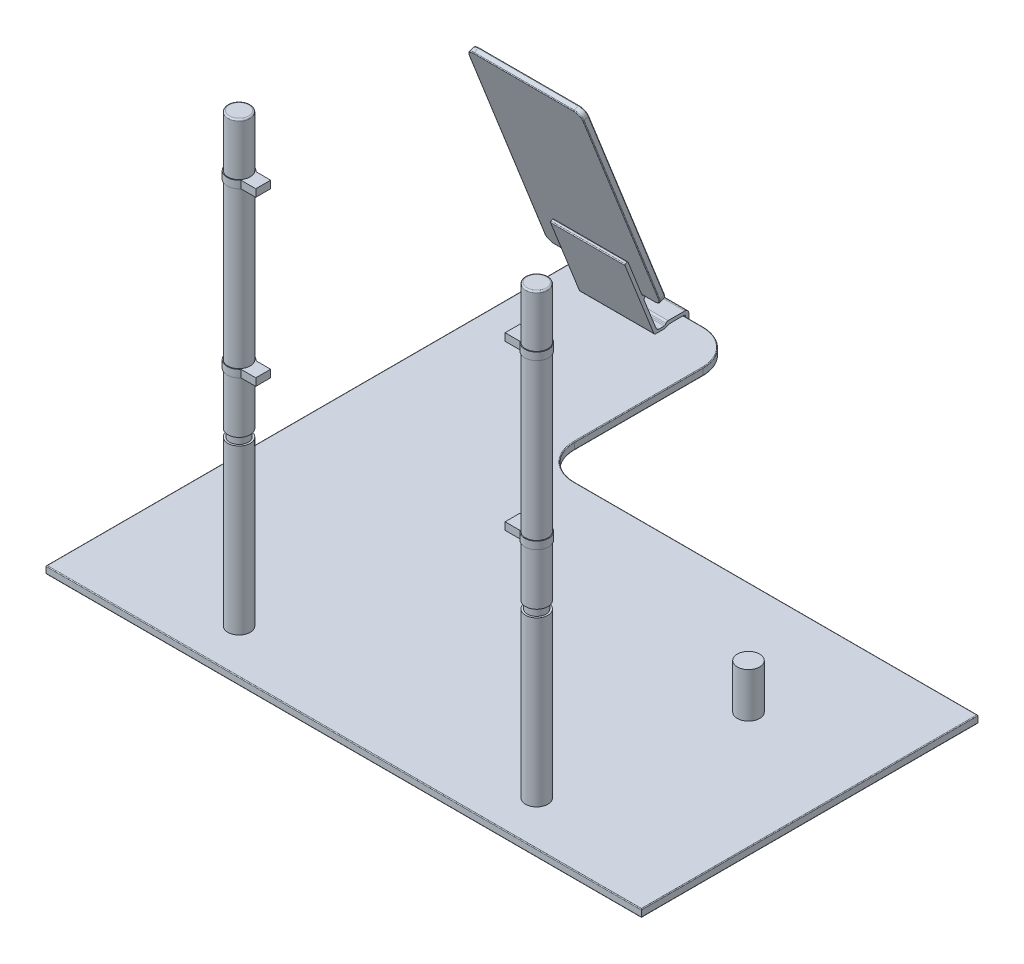
from build123d import *

# Parameters (mm, degrees)
BOSS_EXTRUDE1_DEPTH  = 5
SKETCH3_R            = 7.500000000000014
BOSS_EXTRUDE2_DEPTH  = 300
CUT_EXTRUDE1_START   = -40
SKETCH4_R            = 7.500000000000014
SKETCH4_R_2          = 6.250000000000003
CUT_EXTRUDE1_DEPTH   = 5
CUT_EXTRUDE2_START   = -190
SKETCH4_2_R          = 7.500000000000014
SKETCH4_2_R_2        = 6.250000000000003
CUT_EXTRUDE2_DEPTH   = 5
BOSS_EXTRUDE3_START  = 40
SKETCH6_R            = 8.000000000000014
BOSS_EXTRUDE3_DEPTH  = 5
BOSS_EXTRUDE4_START  = 150
SKETCH6_2_R          = 8.000000000000014
BOSS_EXTRUDE4_DEPTH  = 5
BOSS_EXTRUDE5_START  = -5
BOSS_EXTRUDE5_DEPTH  = 5
BOSS_EXTRUDE6_START  = -115
BOSS_EXTRUDE6_DEPTH  = 5
BOSS_EXTRUDE8_START  = -20
BOSS_EXTRUDE8_DEPTH  = 50
BOSS_EXTRUDE9_DEPTH  = 3.880016648
CUT_EXTRUDE3_DEPTH   = 0.1
SKETCH27_R           = 1.0999999999999939
CUT_EXTRUDE4_DEPTH   = 0.5
FILLET1_R            = 0.5
CUT_EXTRUDE5_DEPTH   = 538.6371298747682
SKETCH29_R           = 7.5000000000000275
BOSS_EXTRUDE10_DEPTH = 30
CUT_EXTRUDE6_DEPTH   = 10
FILLET2_R            = 1
FILLET3_R            = 0.5


with BuildPart() as part:
    # Sketch2 → Boss-Extrude1 (new body)
    with BuildSketch(Plane(origin=(0, 0, 0), x_dir=(1, 0, 0), z_dir=(0, 1, 0))):
        Polygon((199.99999999999997, -224.99999999999997), (-200.00000000000003, -225.00000000000003), (-200.00000000000003, 224.99999999999997), (199.99999999999997, 225.00000000000003), align=None)
    extrude(amount=BOSS_EXTRUDE1_DEPTH)

    # Sketch3 → Boss-Extrude2 (add)
    with BuildSketch(Plane(origin=(0, 5, 0), x_dir=(1, 0, 0), z_dir=(0, 1, 0))):
        with Locations(Location((-100, -104.97234579125673, 0), (0, 0, 270))):
            Circle(SKETCH3_R)
        with Locations(Location((100, -104.97234579125673, 0), (0, 0, 270))):
            Circle(SKETCH3_R)
    extrude(amount=BOSS_EXTRUDE2_DEPTH)

    # Sketch4 → Cut-Extrude1 (cut)
    # profile 1 of 2: a face of its own
    with BuildSketch(Plane(origin=(0, 305, 0), x_dir=(1, 0, 0), z_dir=(0, 1, 0)).offset(CUT_EXTRUDE1_START)):
        with Locations(Location((100, -104.97234579125673, 0), (0, 0, 270))):
            Circle(SKETCH4_R)
        with Locations(Location((100, -104.97234579125673, 0), (0, 0, 270))):
            Circle(SKETCH4_R_2, mode=Mode.SUBTRACT)
    # profile 2 of 2: a face of its own
    with BuildSketch(Plane(origin=(0, 305, 0), x_dir=(1, 0, 0), z_dir=(0, 1, 0)).offset(CUT_EXTRUDE1_START)):
        with Locations(Location((-100, -104.97234579125673, 0), (0, 0, 270))):
            Circle(SKETCH4_R)
        with Locations(Location((-100, -104.97234579125673, 0), (0, 0, 270))):
            Circle(SKETCH4_R_2, mode=Mode.SUBTRACT)
    extrude(amount=CUT_EXTRUDE1_DEPTH, mode=Mode.SUBTRACT)

    # Sketch4<2> → Cut-Extrude2 (cut)
    # profile 1 of 2: a face of its own
    with BuildSketch(Plane(origin=(0, 305, 0), x_dir=(1, 0, 0), z_dir=(0, 1, 0)).offset(CUT_EXTRUDE2_START)):
        with Locations(Location((100, -104.97234579125673, 0), (0, 0, 270))):
            Circle(SKETCH4_2_R)
        with Locations(Location((100, -104.97234579125673, 0), (0, 0, 270))):
            Circle(SKETCH4_2_R_2, mode=Mode.SUBTRACT)
    # profile 2 of 2: a face of its own
    with BuildSketch(Plane(origin=(0, 305, 0), x_dir=(1, 0, 0), z_dir=(0, 1, 0)).offset(CUT_EXTRUDE2_START)):
        with Locations(Location((-100, -104.97234579125673, 0), (0, 0, 270))):
            Circle(SKETCH4_2_R)
        with Locations(Location((-100, -104.97234579125673, 0), (0, 0, 270))):
            Circle(SKETCH4_2_R_2, mode=Mode.SUBTRACT)
    extrude(amount=CUT_EXTRUDE2_DEPTH, mode=Mode.SUBTRACT)

    # Sketch6 → Boss-Extrude3 (add)
    with BuildSketch(Plane(origin=(0, 114.99999999999999, 0), x_dir=(1, 0, 0), z_dir=(0, 1, 0)).offset(BOSS_EXTRUDE3_START)):
        with Locations(Location((-100, -104.97234579125673, 0), (0, 0, 270))):
            Circle(SKETCH6_R)
        with Locations(Location((100, -104.97234579125673, 0), (0, 0, 270))):
            Circle(SKETCH6_R)
    extrude(amount=BOSS_EXTRUDE3_DEPTH)

    # Sketch6<2> → Boss-Extrude4 (add)
    with BuildSketch(Plane(origin=(0, 114.99999999999999, 0), x_dir=(1, 0, 0), z_dir=(0, 1, 0)).offset(BOSS_EXTRUDE4_START)):
        with Locations(Location((-100, -104.97234579125673, 0), (0, 0, 270))):
            Circle(SKETCH6_2_R)
        with Locations(Location((100, -104.97234579125673, 0), (0, 0, 270))):
            Circle(SKETCH6_2_R)
    extrude(amount=BOSS_EXTRUDE4_DEPTH)

    # Sketch7 → Boss-Extrude5 (add)
    with BuildSketch(Plane(origin=(0, 270, 0), x_dir=(1, 0, 0), z_dir=(0, 1, 0)).offset(BOSS_EXTRUDE5_START)):
        with BuildLine():
            Line((-83.7550020016016, -99.97234579125667), (-93.75500200160158, -99.9723457912567))
            ThreePointArc((-93.75500200160158, -99.9723457912567), (-92.451490743624, -102.3228160204471), (-91.99999999999997, -104.97234579125671))
            Line((-91.99999999999999, -104.97234579125671), (-83.75500200160157, -104.97234579125671))
            Line((-83.75500200160158, -104.97234579125671), (-83.7550020016016, -99.97234579125667))
        make_face()
        with BuildLine():
            Line((-83.75500200160157, -104.97234579125671), (-91.99999999999999, -104.97234579125671))
            ThreePointArc((-91.99999999999997, -104.97234579125671), (-92.451490743624, -107.62187556206632), (-93.75500200160158, -109.97234579125671))
            Line((-93.75500200160158, -109.97234579125671), (-83.75500200160157, -109.97234579125671))
            Line((-83.75500200160157, -109.97234579125671), (-83.75500200160158, -104.97234579125671))
        make_face()
        with BuildLine():
            Line((83.75500200160158, -104.9723457912567), (92.00000000000001, -104.97234579125669))
            ThreePointArc((91.99999999999997, -104.97234579125669), (92.45149074362402, -102.32281602044706), (93.75500200160161, -99.97234579125667))
            Line((93.75500200160161, -99.97234579125667), (83.75500200160158, -99.97234579125671))
            Line((83.75500200160158, -99.97234579125671), (83.75500200160158, -104.9723457912567))
        make_face()
        with BuildLine():
            Line((83.75500200160158, -109.9723457912567), (93.75500200160161, -109.97234579125674))
            ThreePointArc((93.75500200160161, -109.97234579125674), (92.45149074362402, -107.62187556206632), (91.99999999999997, -104.97234579125669))
            Line((92.00000000000001, -104.97234579125669), (83.75500200160158, -104.9723457912567))
            Line((83.75500200160158, -104.9723457912567), (83.75500200160158, -109.9723457912567))
        make_face()
    extrude(amount=BOSS_EXTRUDE5_DEPTH)

    # Sketch7<4> → Boss-Extrude6 (add)
    with BuildSketch(Plane(origin=(0, 270, 0), x_dir=(1, 0, 0), z_dir=(0, 1, 0)).offset(BOSS_EXTRUDE6_START)):
        with BuildLine():
            Line((-83.7550020016016, -99.97234579125667), (-93.75500200160158, -99.9723457912567))
            ThreePointArc((-93.75500200160158, -99.9723457912567), (-92.451490743624, -102.3228160204471), (-91.99999999999997, -104.97234579125671))
            Line((-91.99999999999999, -104.97234579125671), (-83.75500200160157, -104.97234579125671))
            Line((-83.75500200160158, -104.97234579125671), (-83.7550020016016, -99.97234579125667))
        make_face()
        with BuildLine():
            Line((-83.75500200160157, -104.97234579125671), (-91.99999999999999, -104.97234579125671))
            ThreePointArc((-91.99999999999997, -104.97234579125671), (-92.451490743624, -107.62187556206632), (-93.75500200160158, -109.97234579125671))
            Line((-93.75500200160158, -109.97234579125671), (-83.75500200160157, -109.97234579125671))
            Line((-83.75500200160157, -109.97234579125671), (-83.75500200160158, -104.97234579125671))
        make_face()
        with BuildLine():
            Line((83.75500200160158, -104.9723457912567), (92.00000000000001, -104.97234579125669))
            ThreePointArc((91.99999999999997, -104.97234579125669), (92.45149074362402, -102.32281602044706), (93.75500200160161, -99.97234579125667))
            Line((93.75500200160161, -99.97234579125667), (83.75500200160158, -99.97234579125671))
            Line((83.75500200160158, -99.97234579125671), (83.75500200160158, -104.9723457912567))
        make_face()
        with BuildLine():
            Line((83.75500200160158, -109.9723457912567), (93.75500200160161, -109.97234579125674))
            ThreePointArc((93.75500200160161, -109.97234579125674), (92.45149074362402, -107.62187556206632), (91.99999999999997, -104.97234579125669))
            Line((92.00000000000001, -104.97234579125669), (83.75500200160158, -104.9723457912567))
            Line((83.75500200160158, -104.9723457912567), (83.75500200160158, -109.9723457912567))
        make_face()
    extrude(amount=BOSS_EXTRUDE6_DEPTH)

    # Sketch23 → Boss-Extrude8 (add)
    with BuildSketch(Plane.ZY.offset(200.00000000000003).offset(BOSS_EXTRUDE8_START)):
        with BuildLine():
            Line((-212.88107324394142, 0), (-211.866530574372, -0.6616861452019758))
            ThreePointArc((-211.866530574372, -0.6616861452019758), (-211.54340988195642, -1.5415291381156035), (-212.2946998831938, -2.1019700431957538))
            Line((-212.2946998831938, -2.1019700431957538), (-225.02556970538384, -2.1019700431957538))
            ThreePointArc((-225.02556970538384, -2.1019700431957538), (-226.5768850591844, -1.4593941841339237), (-227.21946091824623, 0.09192116966664621))
            Line((-227.21946091824623, 0.09192116966664621), (-227.21946091824626, 5.860111733038339))
            ThreePointArc((-227.21946091824626, 5.860111733038339), (-226.4314896127183, 7.762442745604725), (-224.52915860015193, 8.550414051132647))
            Line((-224.52915860015193, 8.550414051132647), (-213.27135518809735, 8.550414051132647))
            ThreePointArc((-213.27135518809735, 8.550414051132647), (-212.45040588904862, 8.339295637420435), (-211.83315348743952, 7.758323857619813))
            Line((-211.83315348743952, 7.758323857619813), (-211.39683542030176, 7.068467858962052))
            ThreePointArc((-211.39683542030176, 7.068467858962052), (-211.11510934669192, 6.803300971033169), (-210.7404120234401, 6.706942396150643))
            Line((-210.7404120234401, 6.706942396150643), (-207.1275411427886, 6.706942396150644))
            ThreePointArc((-207.1275411427886, 6.706942396150644), (-206.00169758958603, 7.053981595132491), (-205.26662130427476, 7.974645902407783))
            Line((-205.26662130427476, 7.974645902407783), (-197.28421549352134, 28.267483265605158))
            ThreePointArc((-197.28421549352134, 28.267483265605158), (-197.30479132924242, 29.41497221523847), (-198.13073785983173, 30.211820119893865))
            Line((-198.13073785983173, 30.211820119893865), (-200.21719439815223, 31.032550237485943))
            ThreePointArc((-200.21719439815223, 31.032550237485943), (-201.25938142712326, 32.0380203490948), (-201.2853442083743, 33.48593259874389))
            Line((-201.2853442083743, 33.48593259874389), (-198.52747831699156, 40.49696728304262))
            ThreePointArc((-198.52747831699156, 40.49696728304262), (-198.13676668756725, 40.901946593039874), (-197.5741282285678, 40.91203536640461))
            Line((-197.5741282285678, 40.91203536640461), (-197.16012506031188, 40.74918276733959))
            ThreePointArc((-197.16012506031188, 40.74918276733959), (-196.8442146802059, 40.444402112003814), (-196.83634477607876, 40.00550727182606))
            Line((-196.83634477607876, 40.00550727182606), (-199.52457812263427, 33.171492138603845))
            ThreePointArc((-199.52457812263427, 33.171492138603845), (-199.51715410161802, 32.757463655670506), (-199.21914217814285, 32.469950883372036))
            Line((-199.21914217814285, 32.469950883372036), (-197.2509177171904, 31.695728624862973))
            ThreePointArc((-197.2509177171904, 31.695728624862973), (-196.3142966300372, 31.71252335008653), (-195.6638811720093, 32.38669013631504))
            Line((-195.6638811720093, 32.38669013631504), (-186.37363240719438, 56.00432017387398))
            ThreePointArc((-186.37363240719438, 56.00432017387398), (-186.11176624047425, 56.27574895045434), (-185.734669769694, 56.28251073673242))
            Line((-185.734669769694, 56.28251073673242), (-184.628790058971, 55.84750105962962))
            ThreePointArc((-184.628790058971, 55.84750105962962), (-184.28715589777454, 55.47169058480904), (-184.37741226392325, 54.97188942289471))
            Line((-184.37741226392325, 54.97188942289471), (-203.66737591728685, 5.933027651126406))
            ThreePointArc((-203.66737591728685, 5.933027651126406), (-204.20839082850034, 5.255420267496785), (-205.0370097924739, 4.999999999999997))
            Line((-205.0370097924739, 4.999999999999997), (-210.73398587732095, 4.999999999999999))
            ThreePointArc((-210.73398587732095, 4.999999999999999), (-211.3233045437551, 5.056007651230381), (-211.8915223829476, 5.222025225081816))
            Line((-211.8915223829476, 5.222025225081816), (-213.67675263902575, 5.933027651126406))
            ThreePointArc((-213.67675263902575, 5.933027651126406), (-214.59876906874644, 6.202415410811886), (-215.55502467234658, 6.293296004595893))
            Line((-215.55502467234658, 6.293296004595893), (-223.73118757359853, 6.293296004595896))
            ThreePointArc((-223.73118757359853, 6.293296004595896), (-224.64568594852972, 5.91449837493119), (-225.02448357819438, 5))
            Line((-225.02448357819438, 5), (-225.0244835781944, 0))
            Line((-225.0244835781944, 0), (-212.88107324394142, 0))
        make_face()
    extrude(amount=-BOSS_EXTRUDE8_DEPTH)

    # Sketch25 → Boss-Extrude9 (add)
    with BuildSketch(Plane(origin=(0, 70.99285621735702, -180.47773056425302), x_dir=(-1, 0, 0), z_dir=(0, 0.3660583341343206, -0.9305919062676218))):
        with BuildLine():
            Line((121.44557292299851, -41.48560268042941), (188.55442707700155, -41.4856026804294))
            ThreePointArc((188.55442707700155, -41.4856026804294), (192.0899609829343, -40.02113658636214), (193.55442707700155, -36.48560268042941))
            Line((193.55442707700155, -36.48560268042941), (193.5544270770015, 102.47172728337648))
            ThreePointArc((193.5544270770015, 102.47172728337648), (192.08996098293423, 106.00726118930922), (188.5544270770015, 107.47172728337651))
            Line((188.5544270770015, 107.47172728337651), (121.44557292299851, 107.47172728337651))
            ThreePointArc((121.44557292299851, 107.47172728337651), (117.91003901706577, 106.00726118930922), (116.44557292299851, 102.47172728337648))
            Line((116.44557292299851, 102.47172728337648), (116.44557292299851, -36.485602680429416))
            ThreePointArc((116.44557292299851, -36.485602680429416), (117.91003901706577, -40.02113658636215), (121.44557292299851, -41.48560268042941))
        make_face()
    extrude(amount=BOSS_EXTRUDE9_DEPTH)

    # Sketch26 → Cut-Extrude3 (cut)
    with BuildSketch(Plane(origin=(0, 72.41316863308745, -184.08844266335038), x_dir=(-1, 0, 0), z_dir=(0, 0.3660583340515873, -0.9305919063001657))):
        with BuildLine():
            Line((187.35185392493997, 103.23269488772996), (122.64814607506003, 103.23269488772996))
            ThreePointArc((122.64814607506003, 103.23269488772996), (120.11070916417982, 102.1816541055773), (119.0596683820272, 99.6442171946971))
            Line((119.0596683820272, 99.6442171946971), (119.05966838202717, -28.31566596762911))
            ThreePointArc((119.05966838202717, -28.31566596762911), (120.11070916417984, -30.8531028785093), (122.64814607506003, -31.90414366066193))
            Line((122.64814607506003, -31.90414366066193), (187.35185392493997, -31.90414366066193))
            ThreePointArc((187.35185392493997, -31.90414366066193), (189.88929083582016, -30.85310287850929), (190.94033161797282, -28.31566596762911))
            Line((190.94033161797282, -28.31566596762911), (190.94033161797282, 99.6442171946971))
            ThreePointArc((190.94033161797282, 99.6442171946971), (189.88929083582016, 102.1816541055773), (187.35185392493997, 103.23269488772996))
        make_face()
    extrude(amount=-CUT_EXTRUDE3_DEPTH, mode=Mode.SUBTRACT)

    # Sketch27 → Cut-Extrude4 (cut)
    with BuildSketch(Plane(origin=(0, 72.41316863308745, -184.08844266335038), x_dir=(-1, 0, 0), z_dir=(0, 0.3660583340515873, -0.9305919063001657))):
        with Locations(Location((155, 105.22644581234451, 0), (0, 0, 90))):
            Circle(SKETCH27_R)
    extrude(amount=-CUT_EXTRUDE4_DEPTH, mode=Mode.SUBTRACT)

    # Fillet1
    fillet1_edges = [part.edges().sort_by_distance(p)[0] for p in [
        (-116.44557292299851, 103.11624538867198, -172.0110572289982),
        (-116.44557292299851, 101.69593295809167, -168.40034514018578),
        (-117.91003901706577, 171.06266791630628, -145.2836012159651),
        (-117.91003901706577, 169.64235548572594, -141.67288912715267),
        (-155, 172.42548821044863, -144.74752119717462),
        (-155, 171.00517577986835, -141.1368091083622),
        (-192.08996098293423, 171.06266791630628, -145.2836012159651),
        (-192.08996098293423, 169.64235548572594, -141.67288912715267),
        (-193.55442707700152, 103.11624538867198, -172.0110572289982),
        (-193.55442707700152, 101.69593295809167, -168.40034514018578),
        (-192.0899609829343, 35.16982286103772, -198.73851324203127),
        (-192.0899609829343, 33.74951043045741, -195.12780115321885),
        (-184.27721353850077, 33.80700256689537, -199.27459326082175),
        (-125.72278646149927, 33.80700256689536, -199.27459326082175),
        (-125.72278646149927, 32.38669013631505, -195.66388117200933),
        (-184.2772135385008, 32.38669013631506, -195.66388117200933),
        (-117.91003901706577, 35.169822861037716, -198.73851324203127),
        (-117.91003901706577, 33.749510430457406, -195.12780115321885),
    ]]
    fillet(fillet1_edges, radius=FILLET1_R)

    # Sketch28 → Cut-Extrude5 (cut, through all)
    with BuildSketch(Plane.ZY.offset(180.00000000000006)):
        with BuildLine():
            Line((-199.2745932612382, 33.807002567059264), (-199.0915640942287, 34.27229852016798))
            ThreePointArc((-199.0915640942287, 34.27229852016798), (-199.0847032299774, 33.889676594590334), (-198.80929730814572, 33.623973400008374))
            Line((-198.80929730814572, 33.623973400008374), (-199.2745932612382, 33.807002567059264))
        make_face()
        with BuildLine():
            Line((-196.12917712514303, 32.56971930338227), (-195.6638811720093, 32.38669013631514))
            Line((-195.6638811720093, 32.38669013631514), (-195.4808520049421, 32.851986089448936))
            ThreePointArc((-195.4808520049421, 32.851986089448936), (-195.74655519954445, 32.576580167608405), (-196.12917712514303, 32.56971930338227))
        make_face()
    extrude(amount=-CUT_EXTRUDE5_DEPTH, mode=Mode.SUBTRACT)

    # Sketch29 → Boss-Extrude10 (add)
    with BuildSketch(Plane(origin=(0, 5, 0), x_dir=(1, 0, 0), z_dir=(0, 1, 0))):
        with Locations(Location((121.2351140396999, 16.078466201206876, 0), (0, 0, 270))):
            Circle(SKETCH29_R)
    extrude(amount=BOSS_EXTRUDE10_DEPTH)

    # Sketch30 → Cut-Extrude6 (cut)
    with BuildSketch(Plane(origin=(0, 5, 0), x_dir=(1, 0, 0), z_dir=(0, 1, 0))):
        with BuildLine():
            Line((-71.24591049688999, 91.50765040648444), (199.99999999999997, 91.50765040648446))
            Line((199.99999999999997, 91.50765040648446), (199.99999999999997, 225.00000000000003))
            Line((199.99999999999997, 225.00000000000003), (-118.300170420602, 225.00000000000006))
            ThreePointArc((-118.300170420602, 225.00000000000006), (-101.4834270489963, 218.03427682053314), (-94.5177038695294, 201.21753344892744))
            Line((-94.5177038695294, 201.21753344892744), (-94.5177038695294, 114.77944377912384))
            ThreePointArc((-94.5177038695294, 114.77944377912384), (-87.70155340105548, 98.32380087495835), (-71.24591049688999, 91.50765040648444))
        make_face()
        Polygon((-200.00000000000003, -134.65503188942068), (199.99999999999994, -134.65503188942068), (199.99999999999997, -224.99999999999997), (-200.00000000000003, -225.00000000000003), align=None)
    extrude(amount=-CUT_EXTRUDE6_DEPTH, mode=Mode.SUBTRACT)

    # Fillet2
    fillet2_edges = [part.edges().sort_by_distance(p)[0] for p in [
        (-100, 305, 97.47234579125671),
        (100, 305, 97.47234579125671),
    ]]
    fillet(fillet2_edges, radius=FILLET2_R)

    # Fillet3
    # the kernel refuses this fillet: 0.5 mm, written as the material it takes off along each edge
    with BuildSketch(Plane(origin=(-201.25000000000003, 0, -224.99999999999997), x_dir=(0, 1, 0), z_dir=(1, 0, -1.4e-16))) as fillet3_piece_1:
        with BuildLine():
            CenterArc((FILLET3_R, FILLET3_R), FILLET3_R, 180, 90)
            Line((-6e-17, FILLET3_R), (0, 0))
            Line((0, 0), (FILLET3_R, 0))
        make_face()
    extrude(amount=21.25, mode=Mode.SUBTRACT)
    with BuildSketch(Plane(origin=(199.99999999999997, 5, -92.75765040648446), x_dir=(-1, 0, 0), z_dir=(0, 0, 1))) as fillet3_piece_2:
        with BuildLine():
            CenterArc((FILLET3_R, FILLET3_R), FILLET3_R, 180, 90)
            Line((0, FILLET3_R), (0, 0))
            Line((0, 0), (FILLET3_R, 0))
        make_face()
    extrude(amount=228.6626822959051, mode=Mode.SUBTRACT)
    with BuildSketch(Plane(origin=(-201.25000000000003, 5, -224.99999999999997), x_dir=(1.4e-16, 0, 1), z_dir=(1, 0, -1.4e-16))) as fillet3_piece_3:
        with BuildLine():
            CenterArc((FILLET3_R, FILLET3_R), FILLET3_R, 180, 90)
            Line((0, FILLET3_R), (0, 0))
            Line((0, 0), (FILLET3_R, 0))
        make_face()
    extrude(amount=82.94982957939803, mode=Mode.SUBTRACT)
    with BuildSketch(Plane(origin=(199.99999999999997, 0, -92.75765040648446), x_dir=(0, 1, 0), z_dir=(0, 0, 1))) as fillet3_piece_4:
        with BuildLine():
            CenterArc((FILLET3_R, FILLET3_R), FILLET3_R, 180, 90)
            Line((-6e-17, FILLET3_R), (0, 0))
            Line((0, 0), (FILLET3_R, 0))
        make_face()
    extrude(amount=228.6626822959051, mode=Mode.SUBTRACT)
    with BuildSketch(Plane(origin=(-130.00000000000003, 0, -224.99999999999997), x_dir=(0, 1, 0), z_dir=(1, 0, -1.4e-16))) as fillet3_piece_5:
        with BuildLine():
            CenterArc((FILLET3_R, FILLET3_R), FILLET3_R, 180, 90)
            Line((-6e-17, FILLET3_R), (0, 0))
            Line((0, 0), (FILLET3_R, 0))
        make_face()
    extrude(amount=11.699829579398028, mode=Mode.SUBTRACT)
    with BuildSketch(Plane(origin=(-118.30017042060197, 0, -201.2175334489275), x_dir=(1, 0, 2.39e-15), z_dir=(-2.39e-15, 0, 1))) as fillet3_piece_6:
        with BuildLine():
            CenterArc((23.78246655107256 - FILLET3_R, FILLET3_R), FILLET3_R, 270, 90)
            Line((23.78246655107256 - FILLET3_R, 0), (23.78246655107256, 0))
            Line((23.78246655107256, 0), (23.78246655107256, FILLET3_R))
        make_face()
    revolve(axis=Axis((-118.30017042060197, 0, -201.2175334489275), (0, 1, 0)), revolution_arc=90.0000000000002, mode=Mode.SUBTRACT)
    with BuildSketch(Plane(origin=(201.24999999999997, 0, -91.50765040648446), x_dir=(0, 1, 0), z_dir=(-1, 0, 5e-17))) as fillet3_piece_7:
        with BuildLine():
            CenterArc((FILLET3_R, -FILLET3_R), FILLET3_R, 90, 90)
            Line((0, -FILLET3_R), (0, 0))
            Line((0, 0), (FILLET3_R, 0))
        make_face()
    extrude(amount=272.49591049688996, mode=Mode.SUBTRACT)
    with BuildSketch(Plane(origin=(-71.24591049689002, 0, -114.77944377912382), x_dir=(-1, 0, -6.1e-16), z_dir=(6.1e-16, 0, -1))) as fillet3_piece_8:
        with BuildLine():
            CenterArc((23.27179337263938 + FILLET3_R, FILLET3_R), FILLET3_R, 180, 90)
            Line((23.27179337263938 + FILLET3_R, 0), (23.27179337263938, 0))
            Line((23.27179337263938, 0), (23.27179337263938, FILLET3_R))
        make_face()
    revolve(axis=Axis((-71.24591049689002, 0, -114.77944377912382), (0, 1, 0)), revolution_arc=90.00000000000011, mode=Mode.SUBTRACT)
    with BuildSketch(Plane(origin=(-94.5177038695294, 0, -114.77944377912384), x_dir=(0, 1, 0), z_dir=(0, 0, -1))) as fillet3_piece_9:
        with BuildLine():
            CenterArc((FILLET3_R, -FILLET3_R), FILLET3_R, 90, 90)
            Line((0, -FILLET3_R), (0, 0))
            Line((0, 0), (FILLET3_R, 0))
        make_face()
    extrude(amount=86.4380896698036, mode=Mode.SUBTRACT)
    with BuildSketch(Plane(origin=(-118.30017042060197, 5, -201.2175334489275), x_dir=(-1.2e-15, 0, -1), z_dir=(-1, 0, 1.2e-15))) as fillet3_piece_10:
        with BuildLine():
            CenterArc((23.78246655107256 - FILLET3_R, FILLET3_R), FILLET3_R, 270, 90)
            Line((23.78246655107256, FILLET3_R), (23.78246655107256, 0))
            Line((23.78246655107256, 0), (23.78246655107256 - FILLET3_R, 0))
        make_face()
    revolve(axis=Axis((-118.30017042060197, 5, -201.2175334489275), (0, -1, 0)), revolution_arc=90.0000000000002, mode=Mode.SUBTRACT)
    with BuildSketch(Plane(origin=(-94.5177038695294, 5, -201.21753344892744), x_dir=(-1, 0, 0), z_dir=(0, 0, 1))) as fillet3_piece_11:
        with BuildLine():
            CenterArc((FILLET3_R, FILLET3_R), FILLET3_R, 180, 90)
            Line((0, FILLET3_R), (0, 0))
            Line((0, 0), (FILLET3_R, 0))
        make_face()
    extrude(amount=86.4380896698036, mode=Mode.SUBTRACT)
    with BuildSketch(Plane(origin=(-71.24591049689002, 5, -114.77944377912382), x_dir=(-1, 0, -6.1e-16), z_dir=(6.1e-16, 0, -1))) as fillet3_piece_12:
        with BuildLine():
            CenterArc((23.27179337263938 + FILLET3_R, -FILLET3_R), FILLET3_R, 90, 90)
            Line((23.27179337263938, -FILLET3_R), (23.27179337263938, 0))
            Line((23.27179337263938, 0), (23.27179337263938 + FILLET3_R, 0))
        make_face()
    revolve(axis=Axis((-71.24591049689002, 5, -114.77944377912382), (0, 1, 0)), revolution_arc=90.00000000000011, mode=Mode.SUBTRACT)
    with BuildSketch(Plane(origin=(-71.24591049688999, 5, -91.50765040648444), x_dir=(5e-17, 0, 1), z_dir=(1, 0, -5e-17))) as fillet3_piece_13:
        with BuildLine():
            CenterArc((FILLET3_R, FILLET3_R), FILLET3_R, 180, 90)
            Line((0, FILLET3_R), (0, 0))
            Line((0, 0), (FILLET3_R, 0))
        make_face()
    extrude(amount=272.49591049688996, mode=Mode.SUBTRACT)
    with BuildSketch(Plane(origin=(201.24999999999997, 0, 134.65503188942068), x_dir=(0, 1, 0), z_dir=(-1, 0, 0))) as fillet3_piece_14:
        with BuildLine():
            CenterArc((FILLET3_R, FILLET3_R), FILLET3_R, 180, 90)
            Line((0, FILLET3_R), (0, 0))
            Line((0, 0), (FILLET3_R, 0))
        make_face()
    extrude(amount=402.5, mode=Mode.SUBTRACT)
    with BuildSketch(Plane(origin=(-201.25000000000003, 5, 134.65503188942068), x_dir=(0, 0, -1), z_dir=(1, 0, 0))) as fillet3_piece_15:
        with BuildLine():
            CenterArc((FILLET3_R, -FILLET3_R), FILLET3_R, 90, 90)
            Line((0, -FILLET3_R), (0, 0))
            Line((0, 0), (FILLET3_R, 0))
        make_face()
    extrude(amount=402.5, mode=Mode.SUBTRACT)
    with BuildSketch(Plane(origin=(-200.00000000000003, 5, 135.90503188942068), x_dir=(1, 0, 0), z_dir=(0, 0, -1))) as fillet3_piece_16:
        with BuildLine():
            CenterArc((FILLET3_R, FILLET3_R), FILLET3_R, 180, 90)
            Line((0, FILLET3_R), (0, 0))
            Line((0, 0), (FILLET3_R, 0))
        make_face()
    extrude(amount=362.1550318894207, mode=Mode.SUBTRACT)
    with BuildSketch(Plane(origin=(-200.00000000000003, 0, 135.90503188942068), x_dir=(0, 1, 0), z_dir=(0, 0, -1))) as fillet3_piece_17:
        with BuildLine():
            CenterArc((FILLET3_R, FILLET3_R), FILLET3_R, 180, 90)
            Line((-6e-17, FILLET3_R), (0, 0))
            Line((0, 0), (FILLET3_R, 0))
        make_face()
    extrude(amount=362.1550318894207, mode=Mode.SUBTRACT)


solid = part.part
